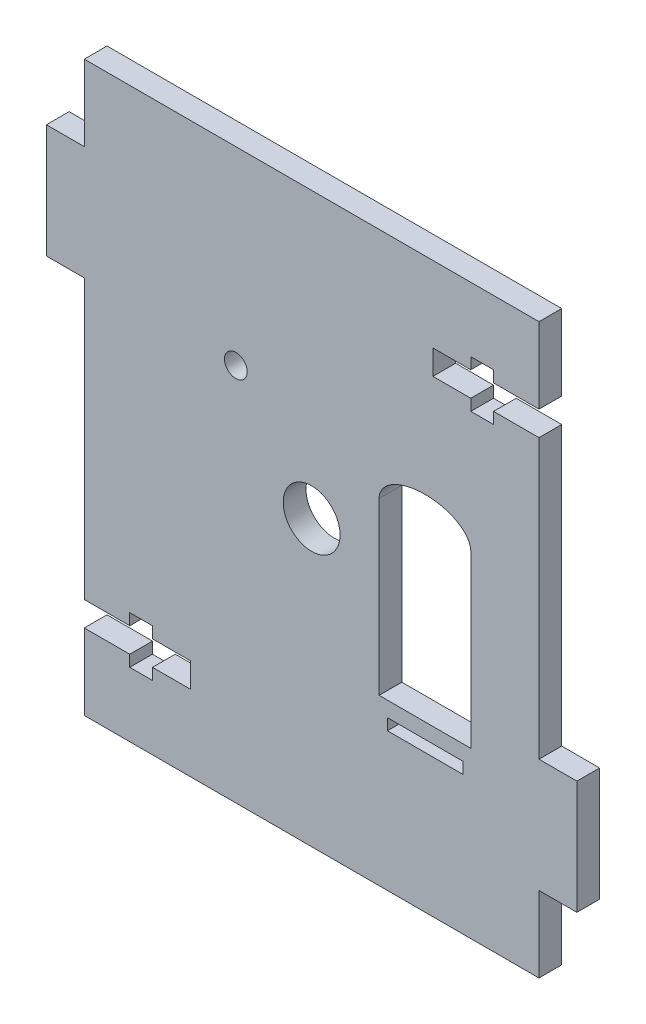
from build123d import *

# Parameters (mm, degrees)
ESQUISSE1_R        = 3.75
ESQUISSE1_R_2      = 1.5
ESQUISSE1_W        = 10
ESQUISSE1_H        = 1.5
BOSS_EXTRU_1_DEPTH = 3


with BuildPart() as part:
    # Esquisse1 → Boss.-Extru.1 (new body)
    with BuildSketch(Plane.XY):
        Polygon((-30, 37.5), (30, 37.5), (30, 27.5), (24, 27.5), (24, 29), (21, 29), (21, 27.5), (16, 27.5), (16, 24.25), (21, 24.25), (21, 22.75), (24, 22.75), (24, 24.25), (30, 24.25), (30, 12.5), (30, -12.5), (35, -12.5), (35, -27.5), (30, -27.5), (30, -37.5), (-30, -37.5), (-30, -27.5), (-24, -27.5), (-24, -29), (-21, -29), (-21, -27.5), (-16, -27.5), (-16, -24.25), (-21, -24.25), (-21, -22.75), (-24, -22.75), (-24, -24.25), (-30, -24.25), (-30, -12.5), (-30, 12.5), (-35, 12.5), (-35, 27.5), (-30, 27.5), align=None)
        Circle(ESQUISSE1_R, mode=Mode.SUBTRACT)
        with Locations((-10, 12.5)):
            Circle(ESQUISSE1_R_2, mode=Mode.SUBTRACT)
        with BuildLine():
            Line((8.9, 6.75), (8.9, -15.75))
            Line((8.9, -15.75), (21, -15.75))
            Line((21, -15.75), (21, 6.75))
            add(Edge.make_bspline(
                [(21, 6.75), (21, 10.25), (14.95, 10.25), (8.9, 10.25), (8.9, 6.75)],
                knots=[0, 0, 0, 1.570796327, 1.570796327, 3.141592654, 3.141592654, 3.141592654], degree=2, weights=[1, 0.707106781, 1, 0.707106781, 1]))
        make_face(mode=Mode.SUBTRACT)
        with Locations((15, -18.5)):
            Rectangle(ESQUISSE1_W, ESQUISSE1_H, mode=Mode.SUBTRACT)
    extrude(amount=BOSS_EXTRU_1_DEPTH)


solid = part.part
